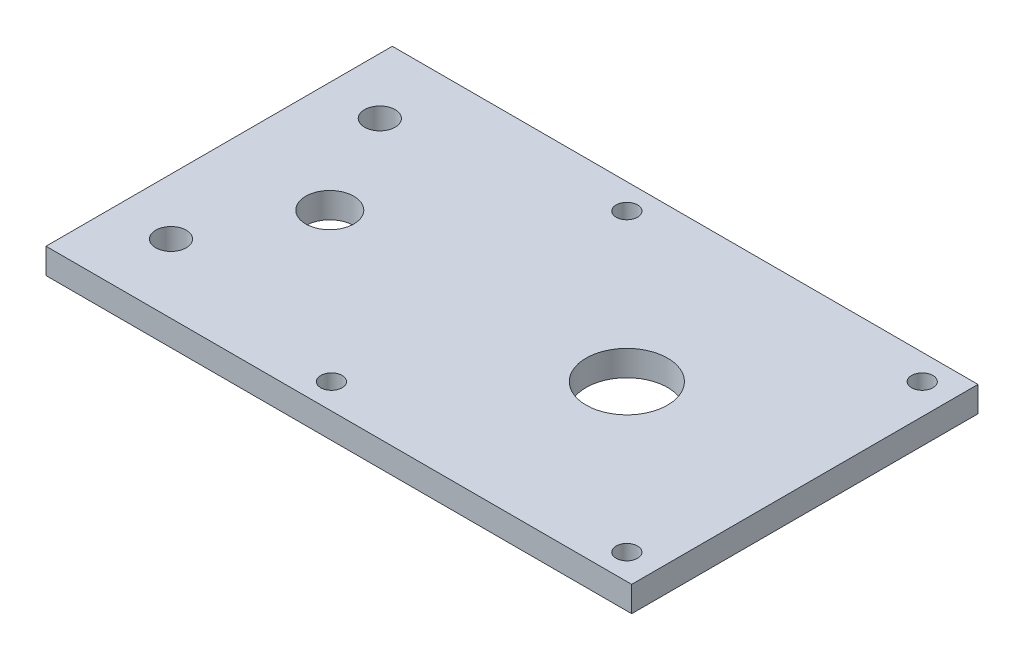
from build123d import *

# Parameters (mm, degrees)
SKETCH1_W           = 115
SKETCH1_H           = 68
SKETCH1_R           = 3
SKETCH1_R_2         = 2.1
SKETCH1_R_3         = 4.725
SKETCH1_R_4         = 8
SKETCH1_R_5         = 2.095
BOSS_EXTRUDE1_DEPTH = 5


with BuildPart() as part:
    # Sketch1 → Boss-Extrude1 (new body)
    with BuildSketch(Plane(origin=(0, 0, 0), x_dir=(1, 0, 0), z_dir=(0, 1, 0))):
        Rectangle(SKETCH1_W, SKETCH1_H)
        with Locations((-46.455, -20.5)):
            Circle(SKETCH1_R, mode=Mode.SUBTRACT)
        with Locations((-6.45, -29)):
            Circle(SKETCH1_R_2, mode=Mode.SUBTRACT)
        with Locations((51.55, -29)):
            Circle(SKETCH1_R_2, mode=Mode.SUBTRACT)
        with Locations((-35.78, 0)):
            Circle(SKETCH1_R_3, mode=Mode.SUBTRACT)
        with Locations((-46.455, 20.5)):
            Circle(SKETCH1_R, mode=Mode.SUBTRACT)
        with Locations((-6.45, 29)):
            Circle(SKETCH1_R_2, mode=Mode.SUBTRACT)
        with Locations((22.55, 0)):
            Circle(SKETCH1_R_4, mode=Mode.SUBTRACT)
        with Locations((51.55, 29)):
            Circle(SKETCH1_R_5, mode=Mode.SUBTRACT)
    extrude(amount=BOSS_EXTRUDE1_DEPTH)


solid = part.part
